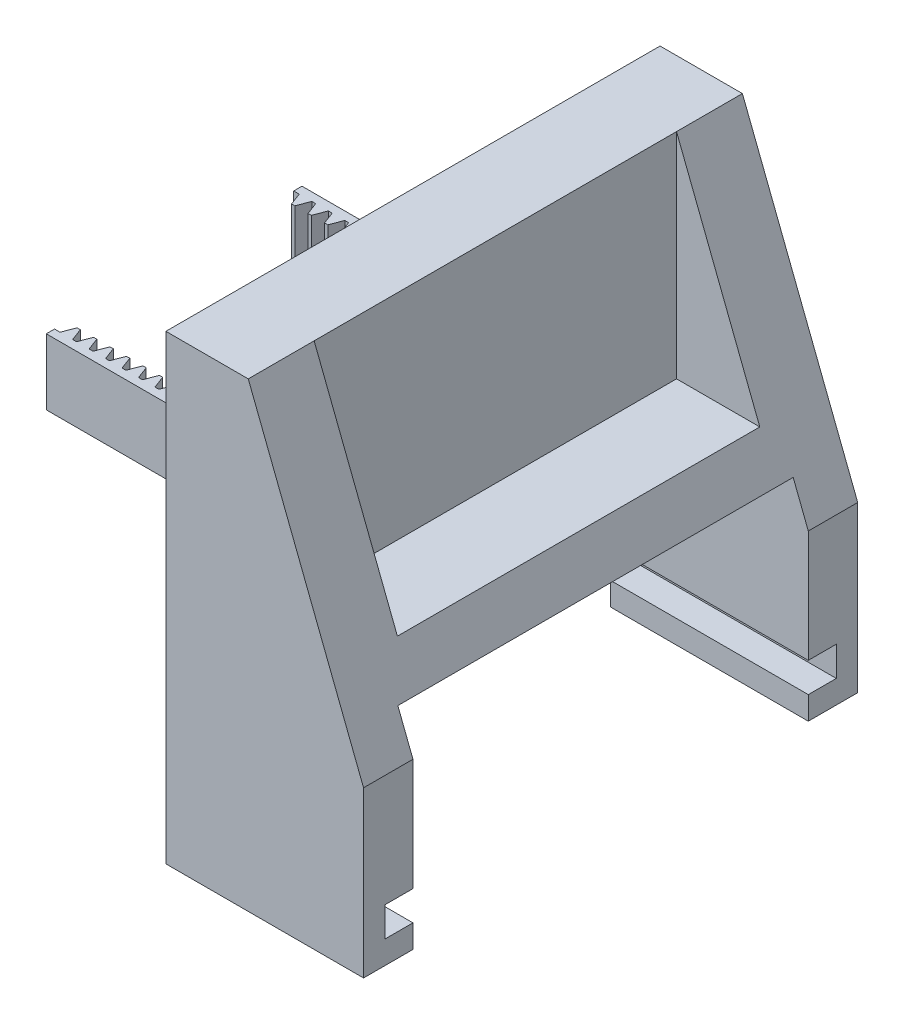
from build123d import *

# Parameters (mm, degrees)
BOSS_EXTRUDE1_DEPTH = 30
SKETCH4_W           = 24
SKETCH4_H           = 14
CUT_EXTRUDE2_DEPTH  = 25
SKETCH5_W           = 1.7
SKETCH5_H           = 1.8
CUT_EXTRUDE3_DEPTH  = 15
CUT_EXTRUDE4_DEPTH  = 11
BOSS_EXTRUDE2_DEPTH = 4


with BuildPart() as part:
    # Sketch1 → Boss-Extrude1 (new body)
    with BuildSketch(Plane.XY):
        Polygon((0, 0), (0, -28), (12, -28), (12, -18), (5, 0), align=None)
    extrude(amount=-BOSS_EXTRUDE1_DEPTH)

    # Sketch4 → Cut-Extrude2 (cut)
    with BuildSketch(Plane.ZY):
        with Locations((-15, -22.638599401)):
            Rectangle(SKETCH4_W, SKETCH4_H)
    extrude(amount=-CUT_EXTRUDE2_DEPTH, mode=Mode.SUBTRACT)

    # Sketch5 → Cut-Extrude3 (cut)
    with BuildSketch(Plane.ZY):
        with Locations((-2.15, -25.7)):
            Rectangle(SKETCH5_W, SKETCH5_H)
    cut_extrude3 = extrude(amount=-CUT_EXTRUDE3_DEPTH, mode=Mode.SUBTRACT)

    # Mirror1: Cut-Extrude3 across plane
    add(cut_extrude3.mirror(Plane.XY.offset(-15)), mode=Mode.SUBTRACT)

    # Sketch6 → Cut-Extrude4 (cut, symmetric)
    with BuildSketch(Plane.XY.offset(-15)):
        Polygon((5, 0), (5, -13), (10.055555556, -13), align=None)
    extrude(amount=CUT_EXTRUDE4_DEPTH, both=True, mode=Mode.SUBTRACT)

    # Sketch7 → Boss-Extrude2 (add)
    with BuildSketch(Plane(origin=(0, -15, 0), x_dir=(1, 0, 0), z_dir=(0, 1, 0))):
        Polygon((0, 22.760856069), (-14.5, 22.760856069), (-14.5, 22.260856069), (-14.164444468, 22.260856069), (-13.881153369, 21.511888257), (-13.681153369, 21.511888257), (-13.4, 22.260856069), (-13.164444468, 22.260856069), (-12.881153369, 21.511888257), (-12.681153369, 21.511888257), (-12.4, 22.260856069), (-12.164444468, 22.260856069), (-11.881153369, 21.511888257), (-11.681153369, 21.511888257), (-11.4, 22.260856069), (-11.164444468, 22.260856069), (-10.881153369, 21.511888257), (-10.681153369, 21.511888257), (-10.4, 22.260856069), (-10.164444468, 22.260856069), (-9.881153369, 21.511888257), (-9.681153369, 21.511888257), (-9.4, 22.260856069), (-9.164444468, 22.260856069), (-8.881153369, 21.511888257), (-8.681153369, 21.511888257), (-8.4, 22.260856069), (-8.164444468, 22.260856069), (-7.881153369, 21.511888257), (-7.681153369, 21.511888257), (-7.4, 22.260856069), (-7.164444468, 22.260856069), (-6.881153369, 21.511888257), (-6.681153369, 21.511888257), (-6.4, 22.260856069), (-6.164444468, 22.260856069), (-5.881153369, 21.511888257), (-5.681153369, 21.511888257), (-5.4, 22.260856069), (-5.164444468, 22.260856069), (-4.881153369, 21.511888257), (-4.681153369, 21.511888257), (-4.4, 22.260856069), (-4.164444468, 22.260856069), (-3.881153369, 21.511888257), (-3.681153369, 21.511888257), (-3.4, 22.260856069), (-3.164444468, 22.260856069), (-2.881153369, 21.511888257), (-2.681153369, 21.511888257), (-2.4, 22.260856069), (-2.164444468, 22.260856069), (-1.881153369, 21.511888257), (-1.681153369, 21.511888257), (-1.4, 22.260856069), (-1.164444468, 22.260856069), (-0.881153369, 21.511888257), (-0.681153369, 21.511888257), (-0.4, 22.260856069), (0, 22.260856069), align=None)
    boss_extrude2 = extrude(amount=BOSS_EXTRUDE2_DEPTH)

    # Mirror2: Boss-Extrude2 across plane
    add(boss_extrude2.mirror(Plane.XY.offset(-15)))


solid = part.part
